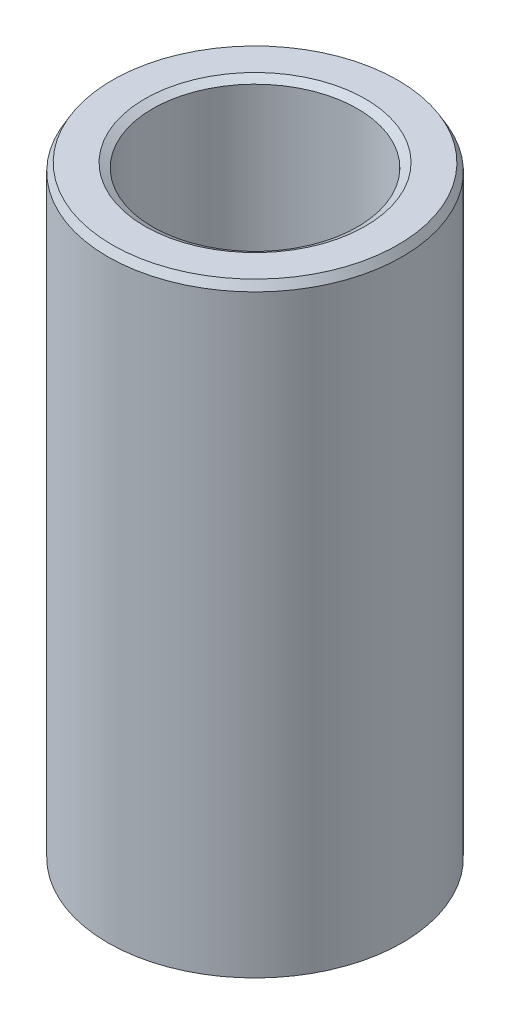
from build123d import *
from OCP.BRepFilletAPI import BRepFilletAPI_MakeChamfer

# Parameters (mm, degrees)
SKETCH1_R           = 40
BOSS_EXTRUDE1_DEPTH = 164.70426143
SKETCH2_R           = 27.81038822
CUT_EXTRUDE1_DEPTH  = 175.147907634
CHAMFER1_SIZE       = 2.14485941
CHAMFER1_SIZE2      = 1.238335158


with BuildPart() as part:
    # Sketch1 → Boss-Extrude1 (new body)
    with BuildSketch(Plane(origin=(0, 0, 0), x_dir=(1, 0, 0), z_dir=(0, 1, 0))):
        Circle(SKETCH1_R)
    extrude(amount=BOSS_EXTRUDE1_DEPTH)

    # Sketch2 → Cut-Extrude1 (cut, through all)
    with BuildSketch(Plane(origin=(0, 0, 0), x_dir=(1, 0, 0), z_dir=(0, 1, 0))):
        Circle(SKETCH2_R)
    extrude(amount=CUT_EXTRUDE1_DEPTH, mode=Mode.SUBTRACT)

    # Chamfer1: one chamfer whose edges measure the first distance from different faces: ONE call of the kernel's chamfer builder (chamfer() names one face for all edges)
    chamfer1_edges_1 = [part.edges().sort_by_distance(p)[0] for p in [
        (-27.81038822, 164.70426143, 0),
    ]]
    chamfer1_side_1 = [part.faces().sort_by_distance(p)[0] for p in [
        (-38.86862915, 164.70426143, 0),
    ]]
    chamfer1_edges_2 = [part.edges().sort_by_distance(p)[0] for p in [
        (-27.81038822, 0, 0),
    ]]
    chamfer1_side_2 = [part.faces().sort_by_distance(p)[0] for p in [
        (-27.81038822, 82.352130715, 0),
    ]]
    chamfer1_edges_3 = [part.edges().sort_by_distance(p)[0] for p in [
        (-40, 0, 0),
    ]]
    chamfer1_side_3 = [part.faces().sort_by_distance(p)[0] for p in [
        (-38.86862915, 0, 0),
    ]]
    chamfer1_edges_4 = [part.edges().sort_by_distance(p)[0] for p in [
        (-40, 164.70426143, 0),
    ]]
    chamfer1_side_4 = [part.faces().sort_by_distance(p)[0] for p in [
        (-40, 82.352130715, 0),
    ]]
    chamfer1 = BRepFilletAPI_MakeChamfer(part.part.solid().wrapped)
    for e in chamfer1_edges_1:
        chamfer1.Add(CHAMFER1_SIZE, CHAMFER1_SIZE2, e.wrapped, chamfer1_side_1[0].wrapped)  # the first distance lies on this face
    for e in chamfer1_edges_2:
        chamfer1.Add(CHAMFER1_SIZE, CHAMFER1_SIZE2, e.wrapped, chamfer1_side_2[0].wrapped)  # the first distance lies on this face
    for e in chamfer1_edges_3:
        chamfer1.Add(CHAMFER1_SIZE, CHAMFER1_SIZE2, e.wrapped, chamfer1_side_3[0].wrapped)  # the first distance lies on this face
    for e in chamfer1_edges_4:
        chamfer1.Add(CHAMFER1_SIZE, CHAMFER1_SIZE2, e.wrapped, chamfer1_side_4[0].wrapped)  # the first distance lies on this face
    add(Compound.cast(chamfer1.Shape()), mode=Mode.REPLACE)


solid = part.part
